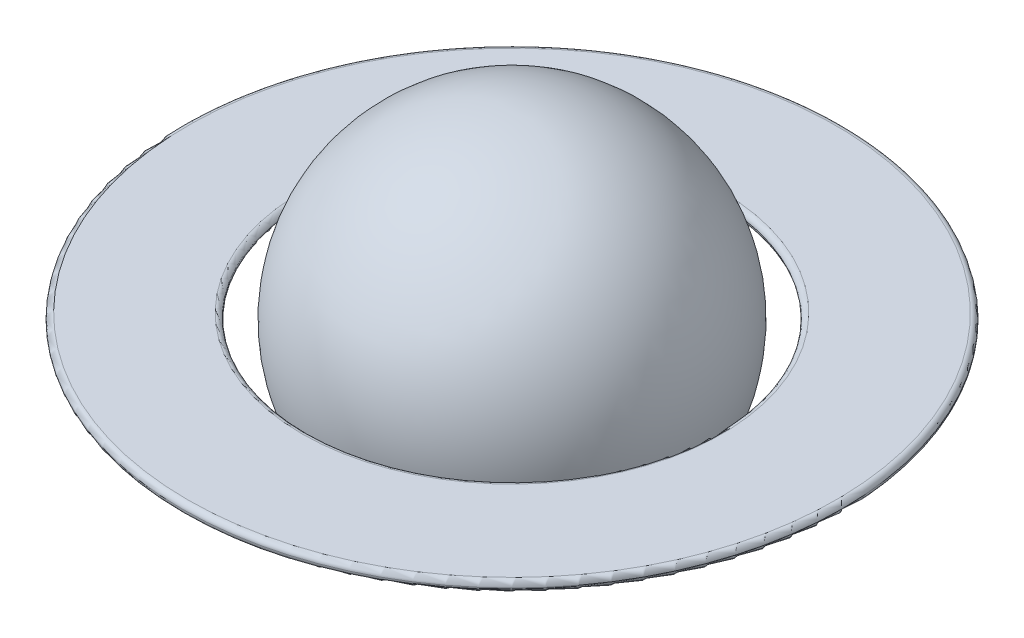
from build123d import *

# Parameters (mm, degrees)
BOSS_EXTRU_1_DEPTH      = 15
BOSS_EXTRU_1_DEPTH_BACK = 15
ESQUISSE2_R             = 916.857366042
ESQUISSE2_R_2           = 569.021341934
CONG_1_R                = 15


with BuildPart() as part:
    # Esquisse1 → Révolution1 (revolve)
    with BuildSketch(Plane.XY):
        with BuildLine():
            Line((0, 0), (0, 1000))
            ThreePointArc((0, 1000), (500, 500), (0, 0))
        make_face()
    revolve(axis=Axis((0, 0, 0), (0, 1, 0)))


with BuildPart() as body_2:
    # Esquisse2 → Boss.-Extru.1 (new, two sides: drawn at the far end of the back side and taken through both)
    with BuildSketch(Plane(origin=(0, 500, 0), x_dir=(1, 0, 0), z_dir=(0, 1, 0)).offset(-BOSS_EXTRU_1_DEPTH_BACK)):
        with Locations(Location((0, 0, 0), (0, 0, 270))):
            Circle(ESQUISSE2_R)
        with Locations(Location((0, 0, 0), (0, 0, 270))):
            Circle(ESQUISSE2_R_2, mode=Mode.SUBTRACT)
    extrude(amount=BOSS_EXTRU_1_DEPTH + BOSS_EXTRU_1_DEPTH_BACK)

    # Congé1
    cong_1_edges = [body_2.edges().sort_by_distance(p)[0] for p in [
        (0, 485, -916.857366042),
        (0, 485, -569.021341934),
        (0, 515, -916.857366042),
        (0, 515, -569.021341934),
    ]]
    fillet(cong_1_edges, radius=CONG_1_R - 0.0001)  # a hair under: the kernel refuses the full size


solid = Compound([part.part, body_2.part])
